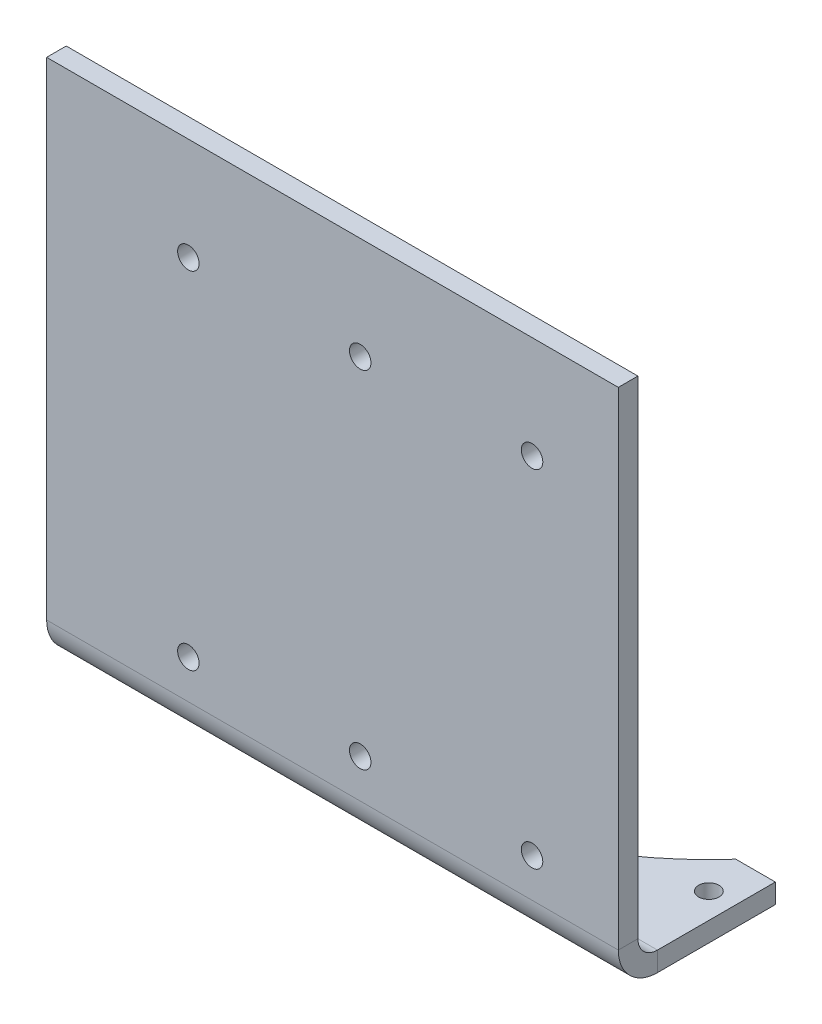
from build123d import *

# Parameters (mm, degrees)
SKETCH1_W                  = 169
SKETCH1_H                  = 152.4
BOSS_EXTRUDE1_DEPTH        = 2.54
SKETCH2_W                  = 169
SKETCH2_H                  = 2.54
BOSS_EXTRUDE2_DEPTH        = 40.64
CUT_EXTRUDE1_REACH         = 122.823
SKETCH4_R                  = 3.175
CUT_EXTRUDE2_REACH         = 178.776
SKETCH3_R                  = 3.020871564
SKETCH3_R_2                = 97.5
CONVERT_SOLID1_START       = -5.790000104
CONVERT_SOLID1_OUTLINE_W   = 169
CONVERT_SOLID1_OUTLINE_H   = 149.86
CONVERT_SOLID1_OUTLINE_R   = 3.175
CONVERT_SOLID1_DEPTH       = 11.580006304
CONVERT_SOLID1_START_2     = -40.64
CONVERT_SOLID1_2_OUTLINE_W = 169
CONVERT_SOLID1_2_OUTLINE_H = 3.2500062
CONVERT_SOLID1_2_DEPTH     = 43.18
CONVERT_SOLID1_START_3     = 2.54
CONVERT_SOLID1_3_OUTLINE_W = 169
CONVERT_SOLID1_3_OUTLINE_H = 2.54
CONVERT_SOLID1_3_DEPTH     = 2.060276352
CONVERT_SOLID1_START_4     = -67.869999896
CONVERT_SOLID1_4_OUTLINE_W = 169
CONVERT_SOLID1_4_OUTLINE_H = 5.790000104
CONVERT_SOLID1_4_DEPTH     = 144.069999896
CONVERT_SOLID1_START_5     = -79.4500062
CONVERT_SOLID1_5_OUTLINE_R = 3.020871564
CONVERT_SOLID1_5_DEPTH     = 3.2500062
CONVERT_SOLID1_6_OUTLINE_W = 169
CONVERT_SOLID1_6_OUTLINE_H = 2.54
CONVERT_SOLID1_6_DEPTH     = 0.546460785
CONVERT_SOLID1_START_6     = -85
CONVERT_SOLID1_7_DEPTH     = 170


with BuildPart() as part:
    # Sketch1 → Boss-Extrude1 (new body)
    with BuildSketch(Plane.XY):
        Rectangle(SKETCH1_W, SKETCH1_H)
    extrude(amount=BOSS_EXTRUDE1_DEPTH)

    # Sketch2 → Boss-Extrude2 (add)
    with BuildSketch(Plane(origin=(0, 0, 0), x_dir=(-1, 0, 0), z_dir=(0, 0, -1))):
        with Locations((0, -74.93)):
            Rectangle(SKETCH2_W, SKETCH2_H)
    extrude(amount=BOSS_EXTRUDE2_DEPTH)

    # Sketch4 → Cut-Extrude1 (cut, up to next)
    with BuildSketch(Plane(origin=(0, 0, 0), x_dir=(-1, 0, 0), z_dir=(0, 0, -1)), mode=Mode.PRIVATE) as cut_extrude1_sk1:
        with Locations((-59, 45.9)):
            Circle(SKETCH4_R)
    cut_extrude1_tool1 = extrude(cut_extrude1_sk1.sketch, amount=-CUT_EXTRUDE1_REACH, mode=Mode.PRIVATE) & part.part
    # Sketch4 → Cut-Extrude1 (cut, up to next)
    with BuildSketch(Plane(origin=(0, 0, 0), x_dir=(-1, 0, 0), z_dir=(0, 0, -1)), mode=Mode.PRIVATE) as cut_extrude1_sk2:
        with Locations((-59, -56.4)):
            Circle(SKETCH4_R)
    cut_extrude1_tool2 = extrude(cut_extrude1_sk2.sketch, amount=-CUT_EXTRUDE1_REACH, mode=Mode.PRIVATE) & part.part
    # Sketch4 → Cut-Extrude1 (cut, up to next)
    with BuildSketch(Plane(origin=(0, 0, 0), x_dir=(-1, 0, 0), z_dir=(0, 0, -1)), mode=Mode.PRIVATE) as cut_extrude1_sk3:
        with Locations((-8.2, 45.9)):
            Circle(SKETCH4_R)
    cut_extrude1_tool3 = extrude(cut_extrude1_sk3.sketch, amount=-CUT_EXTRUDE1_REACH, mode=Mode.PRIVATE) & part.part
    # Sketch4 → Cut-Extrude1 (cut, up to next)
    with BuildSketch(Plane(origin=(0, 0, 0), x_dir=(-1, 0, 0), z_dir=(0, 0, -1)), mode=Mode.PRIVATE) as cut_extrude1_sk4:
        with Locations((42.6, 45.9)):
            Circle(SKETCH4_R)
    cut_extrude1_tool4 = extrude(cut_extrude1_sk4.sketch, amount=-CUT_EXTRUDE1_REACH, mode=Mode.PRIVATE) & part.part
    # Sketch4 → Cut-Extrude1 (cut, up to next)
    with BuildSketch(Plane(origin=(0, 0, 0), x_dir=(-1, 0, 0), z_dir=(0, 0, -1)), mode=Mode.PRIVATE) as cut_extrude1_sk5:
        with Locations((42.6, -56.4)):
            Circle(SKETCH4_R)
    cut_extrude1_tool5 = extrude(cut_extrude1_sk5.sketch, amount=-CUT_EXTRUDE1_REACH, mode=Mode.PRIVATE) & part.part
    # Sketch4 → Cut-Extrude1 (cut, up to next)
    with BuildSketch(Plane(origin=(0, 0, 0), x_dir=(-1, 0, 0), z_dir=(0, 0, -1)), mode=Mode.PRIVATE) as cut_extrude1_sk6:
        with Locations((-8.2, -56.4)):
            Circle(SKETCH4_R)
    cut_extrude1_tool6 = extrude(cut_extrude1_sk6.sketch, amount=-CUT_EXTRUDE1_REACH, mode=Mode.PRIVATE) & part.part
    add(cut_extrude1_tool1.solids().sort_by_distance((59, 45.9, 0))[0], mode=Mode.SUBTRACT)
    add(cut_extrude1_tool2.solids().sort_by_distance((59, -56.4, 0))[0], mode=Mode.SUBTRACT)
    add(cut_extrude1_tool3.solids().sort_by_distance((8.2, 45.9, 0))[0], mode=Mode.SUBTRACT)
    add(cut_extrude1_tool4.solids().sort_by_distance((-42.6, 45.9, 0))[0], mode=Mode.SUBTRACT)
    add(cut_extrude1_tool5.solids().sort_by_distance((-42.6, -56.4, 0))[0], mode=Mode.SUBTRACT)
    add(cut_extrude1_tool6.solids().sort_by_distance((8.2, -56.4, 0))[0], mode=Mode.SUBTRACT)

    # Sketch3 → Cut-Extrude2 (cut, up to next)
    with BuildSketch(Plane(origin=(0, -73.66, 0), x_dir=(1, 0, 0), z_dir=(0, 1, 0)), mode=Mode.PRIVATE) as cut_extrude2_sk1:
        with Locations(Location((77, 28.473587136, 0), (0, 0, 180))):
            Circle(SKETCH3_R)
    cut_extrude2_tool1 = extrude(cut_extrude2_sk1.sketch, amount=-CUT_EXTRUDE2_REACH, mode=Mode.PRIVATE) & part.part
    # Sketch3 → Cut-Extrude2 (cut, up to next)
    with BuildSketch(Plane(origin=(0, -73.66, 0), x_dir=(1, 0, 0), z_dir=(0, 1, 0)), mode=Mode.PRIVATE) as cut_extrude2_sk2:
        with Locations(Location((-77, 28.473587136, 0), (0, 0, 180))):
            Circle(SKETCH3_R)
    cut_extrude2_tool2 = extrude(cut_extrude2_sk2.sketch, amount=-CUT_EXTRUDE2_REACH, mode=Mode.PRIVATE) & part.part
    # Sketch3 → Cut-Extrude2 (cut, up to next)
    with BuildSketch(Plane(origin=(0, -73.66, 0), x_dir=(1, 0, 0), z_dir=(0, 1, 0)), mode=Mode.PRIVATE) as cut_extrude2_sk3:
        with Locations((0, 105.473587136)):
            Circle(SKETCH3_R_2)
    cut_extrude2_tool3 = extrude(cut_extrude2_sk3.sketch, amount=-CUT_EXTRUDE2_REACH, mode=Mode.PRIVATE) & part.part
    add(cut_extrude2_tool1.solids().sort_by_distance((77, -73.66, -28.473587))[0], mode=Mode.SUBTRACT)
    add(cut_extrude2_tool2.solids().sort_by_distance((-77, -73.66, -28.473587))[0], mode=Mode.SUBTRACT)
    add(cut_extrude2_tool3.solids().sort_by_distance((0, -73.66, -105.473587))[0], mode=Mode.SUBTRACT)

    # Convert-Solid1: read off the stored shape, not the designer's step
    # Convert-Solid1 outline → Convert-Solid1 (add)
    with BuildSketch(Plane.XY.offset(CONVERT_SOLID1_START)):
        with Locations((0, 1.27)):
            Rectangle(CONVERT_SOLID1_OUTLINE_W, CONVERT_SOLID1_OUTLINE_H)
        with Locations((-42.6, -56.4)):
            Circle(CONVERT_SOLID1_OUTLINE_R, mode=Mode.SUBTRACT)
        with Locations((8.2, -56.4)):
            Circle(CONVERT_SOLID1_OUTLINE_R, mode=Mode.SUBTRACT)
        with Locations((59, -56.4)):
            Circle(CONVERT_SOLID1_OUTLINE_R, mode=Mode.SUBTRACT)
        with Locations((-42.6, 45.9)):
            Circle(CONVERT_SOLID1_OUTLINE_R, mode=Mode.SUBTRACT)
        with Locations((8.2, 45.9)):
            Circle(CONVERT_SOLID1_OUTLINE_R, mode=Mode.SUBTRACT)
        with Locations((59, 45.9)):
            Circle(CONVERT_SOLID1_OUTLINE_R, mode=Mode.SUBTRACT)
    extrude(amount=CONVERT_SOLID1_DEPTH)

    # Convert-Solid1 2 outline → Convert-Solid1 2 (add)
    with BuildSketch(Plane.XY.offset(CONVERT_SOLID1_START_2)):
        with Locations((0, -77.8250031)):
            Rectangle(CONVERT_SOLID1_2_OUTLINE_W, CONVERT_SOLID1_2_OUTLINE_H)
    extrude(amount=CONVERT_SOLID1_2_DEPTH)

    # Convert-Solid1 3 outline → Convert-Solid1 3 (add)
    with BuildSketch(Plane.XY.offset(CONVERT_SOLID1_START_3)):
        with Locations((0, -74.93)):
            Rectangle(CONVERT_SOLID1_3_OUTLINE_W, CONVERT_SOLID1_3_OUTLINE_H)
    extrude(amount=CONVERT_SOLID1_3_DEPTH)

    # Convert-Solid1 4 outline → Convert-Solid1 4 (cut)
    with BuildSketch(Plane(origin=(0, 0, 0), x_dir=(1, 0, 0), z_dir=(0, 1, 0)).offset(CONVERT_SOLID1_START_4)):
        with Locations((0, 2.895000052)):
            Rectangle(CONVERT_SOLID1_4_OUTLINE_W, CONVERT_SOLID1_4_OUTLINE_H)
    extrude(amount=CONVERT_SOLID1_4_DEPTH, mode=Mode.SUBTRACT)

    # Convert-Solid1 5 outline → Convert-Solid1 5 (cut)
    with BuildSketch(Plane(origin=(0, 0, 0), x_dir=(1, 0, 0), z_dir=(0, 1, 0)).offset(CONVERT_SOLID1_START_5)):
        with BuildLine():
            Line((72.820711196, 40.64), (-72.820711196, 40.64))
            ThreePointArc((-72.820711196, 40.64), (0, 7.973587136), (72.820711196, 40.64))
        make_face()
        with Locations((-77, 28.473587136)):
            Circle(CONVERT_SOLID1_5_OUTLINE_R)
        with Locations((77, 28.473587136)):
            Circle(CONVERT_SOLID1_5_OUTLINE_R)
    extrude(amount=CONVERT_SOLID1_5_DEPTH, mode=Mode.SUBTRACT)

    # Convert-Solid1 6 outline → Convert-Solid1 6 (cut)
    with BuildSketch(Plane(origin=(0, 0, 0), x_dir=(1, 0, 0), z_dir=(0, 1, 0)).offset(CONVERT_SOLID1_START_5)):
        with Locations((0, -1.27)):
            Rectangle(CONVERT_SOLID1_6_OUTLINE_W, CONVERT_SOLID1_6_OUTLINE_H)
    extrude(amount=CONVERT_SOLID1_6_DEPTH, mode=Mode.SUBTRACT)

    # Convert-Solid1 7 outline → Convert-Solid1 7 (cut)
    with BuildSketch(Plane.YZ.offset(CONVERT_SOLID1_START_6)):
        with BuildLine():
            Line((-67.869999896, -5.790000104), (-67.869999896, 0))
            ThreePointArc((-67.869999896, 0), (-71.964148233, -1.695851767), (-73.66, -5.790000104))
            Line((-73.66, -5.790000104), (-67.869999896, -5.790000104))
        make_face()
        with BuildLine():
            ThreePointArc((-79.4500062, -5.790000104), (-76.05830088, 2.39830088), (-67.869999896, 5.7900062))
            Line((-67.869999896, 5.7900062), (-73.66, 5.7900062))
            Line((-73.66, 5.7900062), (-73.66, 4.600276352))
            Line((-73.66, 4.600276352), (-76.2, 4.600276352))
            Line((-76.2, 4.600276352), (-76.2, 2.54))
            Line((-76.2, 2.54), (-78.903545415, 2.54))
            Line((-78.903545415, 2.54), (-78.903545415, 0))
            Line((-78.903545415, 0), (-79.4500062, 0))
            Line((-79.4500062, 0), (-79.4500062, -5.790000104))
        make_face()
    extrude(amount=CONVERT_SOLID1_7_DEPTH, mode=Mode.SUBTRACT)


solid = part.part
